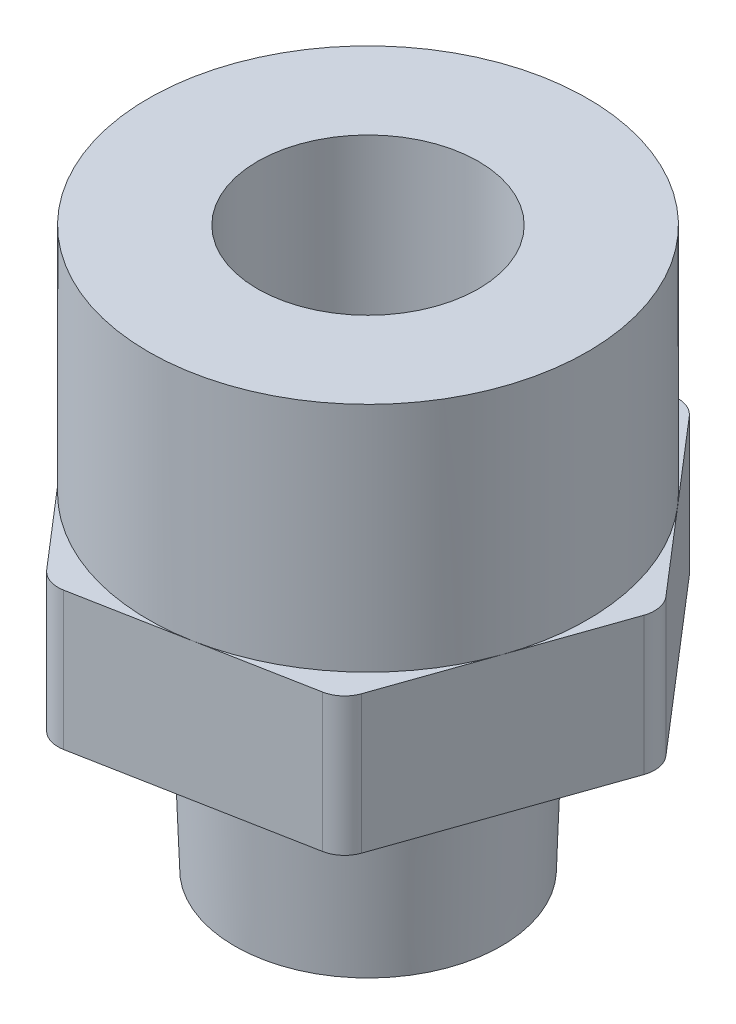
from build123d import *

# Parameters (mm, degrees)
BOSS_EXTRUDE1_DEPTH = 12.7
SKETCH2_R           = 20.193
BOSS_EXTRUDE2_DEPTH = 21.336
SKETCH3_R           = 14.859
BOSS_EXTRUDE3_DEPTH = 4.572
SKETCH4_R           = 12.7
BOSS_EXTRUDE4_DEPTH = 12.7
BOSS_EXTRUDE4_TAPER = 2
SKETCH5_R           = 10.16
CUT_EXTRUDE1_DEPTH  = 61.347161428
FILLET1_R           = 2.54


with BuildPart() as part:
    # Sketch1 → Boss-Extrude1 (new body)
    with BuildSketch(Plane(origin=(0, 0, 0), x_dir=(1, 0, 0), z_dir=(0, 1, 0))):
        Polygon((15.211069479, -17.672003206), (22.909938452, 4.337170984), (7.698868973, 22.00917419), (-15.211069479, 17.672003206), (-22.909938452, -4.337170984), (-7.698868973, -22.00917419), align=None)
    extrude(amount=BOSS_EXTRUDE1_DEPTH)

    # Sketch2 → Boss-Extrude2 (add)
    with BuildSketch(Plane(origin=(0, 12.7, 0), x_dir=(1, 0, 0), z_dir=(0, 1, 0))):
        with Locations(Location((0, 0, 0), (0, 0, 100.720024221))):
            Circle(SKETCH2_R)
    extrude(amount=BOSS_EXTRUDE2_DEPTH)

    # Sketch3 → Boss-Extrude3 (add)
    with BuildSketch(Plane.XZ):
        with Locations(Location((0, 0, 0), (0, 0, 90))):
            Circle(SKETCH3_R)
    extrude(amount=BOSS_EXTRUDE3_DEPTH)

    # Sketch4 → Boss-Extrude4 (add)
    with BuildSketch(Plane.XZ.offset(4.572)):
        Circle(SKETCH4_R)
    extrude(amount=BOSS_EXTRUDE4_DEPTH, taper=BOSS_EXTRUDE4_TAPER)

    # Sketch5 → Cut-Extrude1 (cut, through all)
    with BuildSketch(Plane.XZ.offset(17.272)):
        with Locations(Location((0, 0, 0), (0, 0, 270))):
            Circle(SKETCH5_R)
    extrude(amount=-CUT_EXTRUDE1_DEPTH, mode=Mode.SUBTRACT)

    # Fillet1
    # the kernel refuses this fillet: 2.54 mm, written as the material it takes off along each edge
    with BuildSketch(Plane(origin=(-7.698868973, -3.666174209, 22.00917419), x_dir=(0.9825478481724581, 0, -0.18601001599825806), z_dir=(0, 1, 0)), Plane(origin=(-22.909938452, -3.666174209, 4.337170984), x_dir=(0.6523633232990701, 0, 0.7579063889519556), z_dir=(0, 1, 0)), Plane(origin=(15.211069479, -3.666174209, 17.672003206), x_dir=(0.3301845248733872, 0, -0.9439164049502137), z_dir=(0, 1, 0))) as fillet1_piece_1:
        with BuildLine():
            CenterArc((FILLET1_R * 0.57735026919, FILLET1_R), FILLET1_R, 210, 60)
            Line((-FILLET1_R * 0.288675134595, FILLET1_R * 0.5), (-FILLET1_R * 0.305995642671, FILLET1_R * 0.49))
            Line((-FILLET1_R * 0.305995642671, FILLET1_R * 0.49), (-FILLET1_R * 0.0115470053838, -FILLET1_R * 0.02))
            Line((-FILLET1_R * 0.0115470053838, -FILLET1_R * 0.02), (FILLET1_R * 0.57735026919, -FILLET1_R * 0.02))
            Line((FILLET1_R * 0.57735026919, -FILLET1_R * 0.02), (FILLET1_R * 0.57735026919, 0))
        make_face()
    extrude(amount=20.032348419, mode=Mode.SUBTRACT)
    with BuildSketch(Plane(origin=(-15.211069479, -3.666174209, -17.672003206), x_dir=(0.9825478481724584, 0, -0.18601001599825617), z_dir=(0, 1, 0)), Plane(origin=(7.698868973, -3.666174209, -22.00917419), x_dir=(0.6523633232990698, 0, 0.7579063889519558), z_dir=(0, 1, 0)), Plane(origin=(22.909938452, -3.666174209, -4.337170984), x_dir=(-0.33018452487338784, 0, 0.9439164049502133), z_dir=(0, 1, 0))) as fillet1_piece_2:
        with BuildLine():
            CenterArc((FILLET1_R * 0.57735026919, -FILLET1_R), FILLET1_R, 90, 60)
            Line((-FILLET1_R * 0.288675134595, -FILLET1_R * 0.5), (-FILLET1_R * 0.305995642671, -FILLET1_R * 0.49))
            Line((-FILLET1_R * 0.305995642671, -FILLET1_R * 0.49), (-FILLET1_R * 0.0115470053838, FILLET1_R * 0.02))
            Line((-FILLET1_R * 0.0115470053838, FILLET1_R * 0.02), (FILLET1_R * 0.57735026919, FILLET1_R * 0.02))
            Line((FILLET1_R * 0.57735026919, FILLET1_R * 0.02), (FILLET1_R * 0.57735026919, 0))
        make_face()
    extrude(amount=20.032348419, mode=Mode.SUBTRACT)
    with BuildSketch(Plane(origin=(0, -4.572, 0), x_dir=(0, 0, 1), z_dir=(1, 0, 0))) as fillet1_piece_3:
        with BuildLine():
            CenterArc((12.319, -2.511262432), FILLET1_R, 0, 81.373073441)
            Line((12.7, 0), (12.70762, 0.050225249))
            ThreePointArc((12.70762, 0.050225249), (13.7795, 0.0508), (14.859, 0.0508))
            Line((14.859, 0.0508), (14.9098, 0))
            Line((14.9098, 0), (14.9098, -2.511262432))
            Line((14.9098, -2.511262432), (14.859, -2.511262432))
        make_face()
    revolve(axis=Axis((0, -4.572, 0), (0, -1, 0)), mode=Mode.SUBTRACT)


solid = part.part
